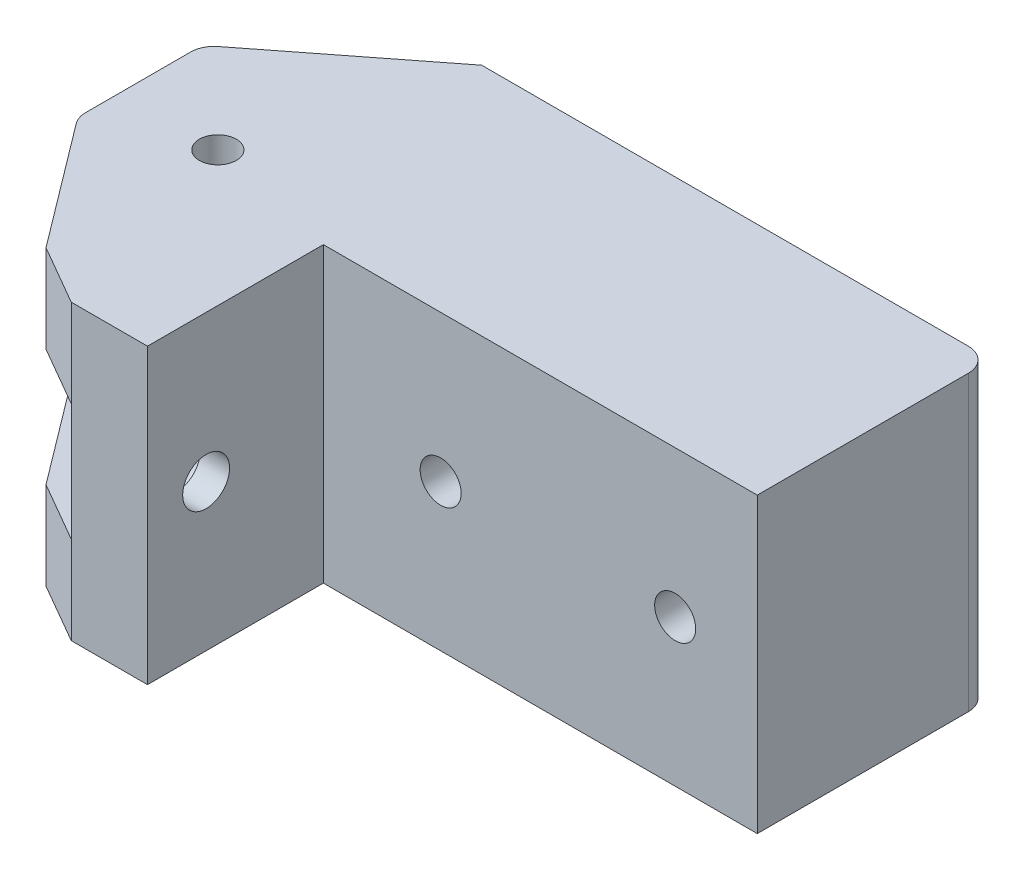
from build123d import *

# Parameters (mm, degrees)
SKETCH1_R           = 1.575
BOSS_EXTRUDE1_DEPTH = 12.5
SKETCH2_W           = 13.385271969
SKETCH2_H           = 10
CUT_EXTRUDE1_DEPTH  = 68.949865099
SKETCH3_R           = 1.75
CUT_EXTRUDE2_DEPTH  = 25
SKETCH4_R           = 4
CUT_EXTRUDE3_DEPTH  = 4
FILLET1_R           = 2
SKETCH5_R           = 2
CUT_EXTRUDE4_DEPTH  = 58.214508649
SKETCH6_R           = 4
CUT_EXTRUDE5_DEPTH  = 4


with BuildPart() as part:
    # Sketch1 → Boss-Extrude1 (new, symmetric)
    with BuildSketch(Plane(origin=(0, 0, 0), x_dir=(1, 0, 0), z_dir=(0, 1, 0))):
        Polygon((0, 0), (-43.5, 0), (-56.885271969, -10.457720596), (-56.885271969, -21.057720596), (-48.596177418, -32.057720596), (-43.5, -35), (-37, -35), (-37, -20), (0, -20), align=None)
        with Locations((-48.5, -17.5)):
            Circle(SKETCH1_R, mode=Mode.SUBTRACT)
    extrude(amount=BOSS_EXTRUDE1_DEPTH, both=True)

    # Sketch2 → Cut-Extrude1 (cut, through all)
    with BuildSketch(Plane.XY.offset(35)):
        with Locations((-50.192635985, 0)):
            Rectangle(SKETCH2_W, SKETCH2_H)
    extrude(amount=-CUT_EXTRUDE1_DEPTH, mode=Mode.SUBTRACT)

    # Sketch3 → Cut-Extrude2 (cut)
    with BuildSketch(Plane.XY.offset(20)):
        with Locations((-27, 0)):
            Circle(SKETCH3_R)
        with Locations((-7, 0)):
            Circle(SKETCH3_R)
    extrude(amount=-CUT_EXTRUDE2_DEPTH, mode=Mode.SUBTRACT)

    # Sketch4 → Cut-Extrude3 (cut)
    with BuildSketch(Plane(origin=(0, 0, 0), x_dir=(-1, 0, 0), z_dir=(0, 0, -1))):
        with Locations((7, 0)):
            Circle(SKETCH4_R)
        with Locations((27, 0)):
            Circle(SKETCH4_R)
    extrude(amount=-CUT_EXTRUDE3_DEPTH, mode=Mode.SUBTRACT)

    # Fillet1
    fillet1_edges = [part.edges().sort_by_distance(p)[0] for p in [
        (0, 0, 0),
        (-56.885271969, 8.75, 10.457720596),
        (-56.885271969, 8.75, 21.057720596),
        (-56.885271969, -8.75, 21.057720596),
        (-56.885271969, -8.75, 10.457720596),
    ]]
    fillet(fillet1_edges, radius=FILLET1_R)

    # Sketch5 → Cut-Extrude4 (cut, through all)
    with BuildSketch(Plane.ZY.offset(43.5)):
        with Locations((30, 0)):
            Circle(SKETCH5_R)
    extrude(amount=-CUT_EXTRUDE4_DEPTH, mode=Mode.SUBTRACT)

    # Sketch6 → Cut-Extrude5 (cut)
    with BuildSketch(Plane.ZY.offset(43.5)):
        with Locations((30, 0)):
            Circle(SKETCH6_R)
    extrude(amount=-CUT_EXTRUDE5_DEPTH, mode=Mode.SUBTRACT)


solid = part.part
